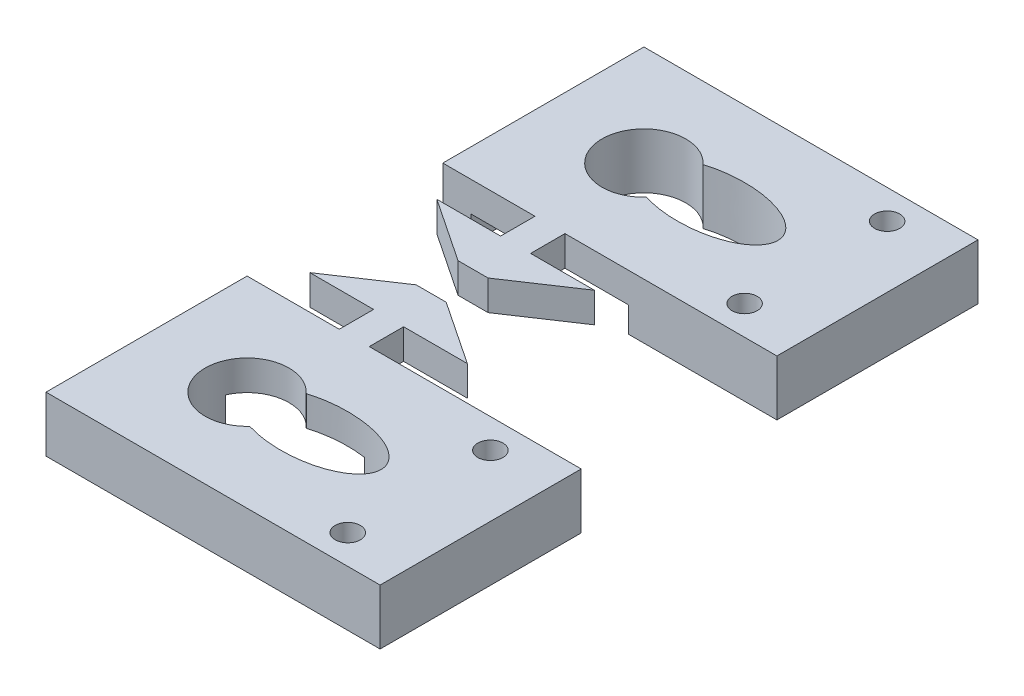
from build123d import *

# Parameters (mm, degrees)
BOSS_EXTRUDE1_DEPTH      = 3.5814
BOSS_EXTRUDE2_DEPTH      = 3.035
BOSS_EXTRUDE2_DEPTH_BACK = 3.035
SKETCH7_W                = 39.878
SKETCH7_H                = 24
CUT_EXTRUDE3_DEPTH       = 39.159389316
CUT_EXTRUDE3_DEPTH_BACK  = 39.159389316
SKETCH5_R                = 1.5
SKETCH8_W                = 18.796
SKETCH8_H                = 3.035
CUT_EXTRUDE4_DEPTH       = 10
CUT_EXTRUDE5_DEPTH       = 2
CUT_EXTRUDE6_DEPTH       = 2


with BuildPart() as part:
    # Sketch1 → Boss-Extrude1 (new body)
    with BuildSketch(Plane(origin=(0, 0, 0), x_dir=(1, 0, 0), z_dir=(0, 1, 0))):
        Polygon((-9.398, 2.05), (-1.7907, 2.05), (-1.7907, -2.05), (-12.79, -2.05), (-12.79, -26.05), (27.088, -26.05), (27.088, -2.05), (1.7907, -2.05), (1.7907, 2.05), (9.398, 2.05), (1.7907, 7.13), (-1.7907, 7.13), align=None)
    extrude(amount=BOSS_EXTRUDE1_DEPTH)

    # Sketch7 → Boss-Extrude2 (add, two sides: drawn at the far end of the back side and taken through both)
    with BuildSketch(Plane(origin=(0, 0, 0), x_dir=(1, 0, 0), z_dir=(0, 1, 0)).offset(-BOSS_EXTRUDE2_DEPTH_BACK)):
        with Locations((7.149, -14.05)):
            Rectangle(SKETCH7_W, SKETCH7_H)
    extrude(amount=BOSS_EXTRUDE2_DEPTH + BOSS_EXTRUDE2_DEPTH_BACK)

    # Sketch5 → Cut-Extrude3 (cut, two sides: drawn at the far end of the back side and taken through both)
    with BuildSketch(Plane(origin=(0, 3.5814, 0), x_dir=(1, 0, 0), z_dir=(0, 1, 0)).offset(-CUT_EXTRUDE3_DEPTH_BACK)):
        with BuildLine():
            ThreePointArc((2.902928009, -10.679201472), (-5.79, -14.05), (2.902928009, -17.420798528))
            add(Edge.make_bspline(
                [(2.902928009, -17.420798528), (15.21, -21.352170028), (15.21, -14.05)],
                knots=[1.002278043, 1.002278043, 1.002278043, 3.141592654, 3.141592654, 3.141592654], degree=2, weights=[1, 0.480424813, 1]))
            add(Edge.make_bspline(
                [(15.21, -14.05), (15.21, -6.747829972), (2.902928009, -10.679201472)],
                knots=[3.141592654, 3.141592654, 3.141592654, 5.280907265, 5.280907265, 5.280907265], degree=2, weights=[1, 0.480424813, 1]))
        make_face()
        with Locations((19.738, -22.559)):
            Circle(SKETCH5_R)
        with Locations((19.738, -5.541)):
            Circle(SKETCH5_R)
    extrude(amount=CUT_EXTRUDE3_DEPTH + CUT_EXTRUDE3_DEPTH_BACK, mode=Mode.SUBTRACT)

    # Sketch8 → Cut-Extrude4 (cut)
    with BuildSketch(Plane(origin=(0, 0, 2.05), x_dir=(-1, 0, 0), z_dir=(0, 0, -1))):
        with Locations((0, -1.5175)):
            Rectangle(SKETCH8_W, SKETCH8_H)
    extrude(amount=-CUT_EXTRUDE4_DEPTH, mode=Mode.SUBTRACT)


with BuildPart() as body_2:
    # Mirror2: mirrored copy
    add(part.part.mirror(Plane(origin=(0, 0, -9.63), x_dir=(1, 0, 0), z_dir=(0, 0, -1))))

    # Sketch9 → Cut-Extrude5 (cut)
    with BuildSketch(Plane(origin=(0, -3.035, 0), x_dir=(-1, 0, 0), z_dir=(0, -1, 0))):
        Polygon((-17.738, 37.495897436), (-17.738, 36.926025641), (-23.436717949, 36.926025641), (-23.436717949, 34.483717949), (-24.088, 34.483717949), (-24.088, 37.495897436), align=None)
        Polygon((-17.575179487, 33.018333333), (-17.575179487, 32.448461538), (-19.447615385, 32.448461538), (-19.447615385, 31.634358974), (-20.017487179, 31.634358974), (-20.017487179, 32.448461538), (-24.088, 32.448461538), (-24.088, 33.018333333), (-20.017487179, 33.018333333), (-20.017487179, 33.832435897), (-19.447615385, 33.832435897), (-19.447615385, 33.018333333), align=None)
        with BuildLine():
            add(Edge.make_bspline(
                [(-23.111076923, 29.965448718), (-23.113108733, 29.93006343), (-23.117068442, 29.861102542), (-23.146170333, 29.76124509), (-23.195273601, 29.669993403), (-23.262741993, 29.58921361), (-23.343290074, 29.52207525), (-23.434309956, 29.47240698), (-23.534456908, 29.441971139), (-23.604412572, 29.438209003), (-23.64024359, 29.436282051)],
                knots=[0, 0, 0, 0, 1.020591893, 1.988988293, 2.974634352, 3.991697318, 5.008760285, 5.983632262, 6.967224335, 8, 8, 8, 8], degree=3))
            add(Edge.make_bspline(
                [(-23.64024359, 29.436282051), (-23.675213037, 29.43828598), (-23.744291317, 29.442244521), (-23.843680497, 29.472343791), (-23.934760899, 29.522464128), (-24.016404016, 29.588755355), (-24.084016838, 29.670013061), (-24.132682258, 29.761465704), (-24.163820493, 29.860863151), (-24.167516873, 29.930023146), (-24.169410256, 29.965448718)],
                knots=[0, 0, 0, 0, 1.009852967, 1.994853009, 2.971120474, 3.99910934, 5.017628188, 6.004685157, 6.977947174, 8, 8, 8, 8], degree=3))
            add(Edge.make_bspline(
                [(-24.169410256, 29.965448718), (-24.167445792, 30.000848781), (-24.163588082, 30.07036554), (-24.133304061, 30.170135394), (-24.083550278, 30.261034458), (-24.016528984, 30.342307987), (-23.934337962, 30.408048617), (-23.844300579, 30.460477937), (-23.744004211, 30.488168669), (-23.675156488, 30.492446223), (-23.64024359, 30.494615385)],
                knots=[0, 0, 0, 0, 1.021616397, 2.006195831, 2.982046417, 4.000130345, 5.027680246, 6.00943514, 6.990578253, 8, 8, 8, 8], degree=3))
            add(Edge.make_bspline(
                [(-23.64024359, 30.494615385), (-23.604471141, 30.49251732), (-23.534748731, 30.48842808), (-23.433690127, 30.460413721), (-23.343708979, 30.408444682), (-23.262618275, 30.341848646), (-23.195738663, 30.261054431), (-23.145557951, 30.170349834), (-23.117297414, 30.070130272), (-23.113178168, 30.000809531), (-23.111076923, 29.965448718)],
                knots=[0, 0, 0, 0, 1.032329927, 2.012066096, 2.992413168, 4.009037178, 5.025661188, 6.000112418, 6.979848586, 8, 8, 8, 8], degree=3))
        make_face()
    extrude(amount=-CUT_EXTRUDE5_DEPTH, mode=Mode.SUBTRACT)


with BuildPart() as part_1:
    add(part.part)

    # Sketch10 → Cut-Extrude6 (cut)
    # profile 1 of 3: a face of its own
    with BuildSketch(Plane.XZ.offset(3.035)):
        with BuildLine():
            add(Edge.make_bspline(
                [(23.111076923, 18.450961538), (23.113178168, 18.486322352), (23.117297414, 18.555643093), (23.145557951, 18.655862654), (23.195738663, 18.746567251), (23.262618275, 18.827361467), (23.343708979, 18.893957503), (23.433690127, 18.945926542), (23.534748731, 18.9739409), (23.604471141, 18.97803014), (23.64024359, 18.980128205)],
                knots=[0, 0, 0, 0, 1.020151414, 1.999887582, 2.974338812, 3.990962822, 5.007586832, 5.987933904, 6.967670073, 8, 8, 8, 8], degree=3))
            add(Edge.make_bspline(
                [(23.64024359, 18.980128205), (23.675162482, 18.977965725), (23.744022024, 18.973701346), (23.844231632, 18.945913902), (23.934315979, 18.89402059), (24.015216612, 18.826937749), (24.083711596, 18.747050426), (24.133227025, 18.655578876), (24.163608262, 18.555896524), (24.167452601, 18.486367731), (24.169410256, 18.450961538)],
                knots=[0, 0, 0, 0, 1.009624703, 1.990965087, 2.972917375, 3.991206001, 5.017354006, 5.993400798, 6.978178195, 8, 8, 8, 8], degree=3))
            add(Edge.make_bspline(
                [(24.169410256, 18.450961538), (24.167523665, 18.415529847), (24.163840545, 18.346357903), (24.13260605, 18.247047191), (24.084184092, 18.155018118), (24.01509192, 18.075151555), (23.934734447, 18.007525099), (23.843611229, 17.957934065), (23.744309211, 17.927737333), (23.675219051, 17.923792076), (23.64024359, 17.921794872)],
                knots=[0, 0, 0, 0, 1.022258411, 1.995716197, 2.98297171, 4.009558169, 5.028281891, 6.00474573, 6.989943903, 8, 8, 8, 8], degree=3))
            add(Edge.make_bspline(
                [(23.64024359, 17.921794872), (23.604412572, 17.923721823), (23.534456908, 17.92748396), (23.434309956, 17.9579198), (23.343290074, 18.007588071), (23.262741993, 18.07472643), (23.195273601, 18.155506224), (23.146170333, 18.246757911), (23.117068442, 18.346615362), (23.113108733, 18.41557625), (23.111076923, 18.450961538)],
                knots=[0, 0, 0, 0, 1.032775665, 2.016367738, 2.991239715, 4.008302682, 5.025365648, 6.011011707, 6.979408107, 8, 8, 8, 8], degree=3))
        make_face()
    # profile 2 of 3: a face of its own
    with BuildSketch(Plane.XZ.offset(3.035)):
        Polygon((17.575179487, 15.398076923), (17.575179487, 15.967948718), (19.447615385, 15.967948718), (19.447615385, 16.782051282), (20.017487179, 16.782051282), (20.017487179, 15.967948718), (24.088, 15.967948718), (24.088, 15.398076923), (20.017487179, 15.398076923), (20.017487179, 14.583974359), (19.447615385, 14.583974359), (19.447615385, 15.398076923), align=None)
    # profile 3 of 3: a face of its own
    with BuildSketch(Plane.XZ.offset(3.035)):
        with BuildLine():
            Line((17.738, 9.617948718), (17.738, 10.888711939))
            add(Edge.make_bspline(
                [(17.738, 10.888711939), (17.738282277, 10.973513701), (17.738824281, 11.136342477), (17.741846451, 11.369611125), (17.750508497, 11.581568858), (17.757962641, 11.772104852), (17.771555163, 11.941215612), (17.784546623, 12.089419696), (17.801553122, 12.216034519), (17.817347246, 12.292680564), (17.824498397, 12.327383814)],
                knots=[0, 0, 0, 0, 1.410062039, 2.707475311, 3.878576406, 4.937260626, 5.877586885, 6.699081471, 7.410979367, 8, 8, 8, 8], degree=3))
            add(Edge.make_bspline(
                [(17.824498397, 12.327383814), (17.835976988, 12.37384151), (17.858689301, 12.465765834), (17.906694128, 12.598118621), (17.96224853, 12.724235532), (18.027490962, 12.84360412), (18.102941892, 12.955584306), (18.187164461, 13.061488405), (18.279988558, 13.160972648), (18.382250961, 13.252738685), (18.491772821, 13.336094467), (18.608253551, 13.409210327), (18.731211529, 13.470991884), (18.860838269, 13.519474548), (18.995701849, 13.560156831), (19.137178756, 13.587490314), (19.284796694, 13.604516403), (19.385237963, 13.606198413), (19.436167067, 13.607051282)],
                knots=[0, 0, 0, 0, 1.02737844, 2.032840108, 3.019645024, 3.985760442, 4.950801802, 5.916702504, 6.889791722, 7.870143693, 8.864820395, 9.842884691, 10.820524757, 11.815201459, 12.812418953, 13.84314332, 14.906358105, 16, 16, 16, 16], degree=3))
            add(Edge.make_bspline(
                [(19.436167067, 13.607051282), (19.520776471, 13.6043861), (19.685871333, 13.599185639), (19.925467504, 13.550698665), (20.148968117, 13.471275551), (20.35609176, 13.361831869), (20.542801074, 13.222459392), (20.706795186, 13.054955842), (20.844027599, 12.859227776), (20.939191973, 12.677020302), (21.000139107, 12.516067397), (21.043022215, 12.383564101), (21.076154638, 12.239025442), (21.105836592, 12.083836278), (21.128246094, 11.917350789), (21.144659201, 11.739968003), (21.154917261, 11.551561413), (21.156444899, 11.422131959), (21.157230769, 11.355548878)],
                knots=[0, 0, 0, 0, 1.260483769, 2.459530307, 3.627416485, 4.787058657, 5.939039949, 7.08810263, 8.267026773, 9.491475466, 10.141966685, 10.831826277, 11.566392101, 12.351337768, 13.187381173, 14.07005841, 15.007169909, 16, 16, 16, 16], degree=3))
            Line((21.157230769, 11.355548878), (24.088, 13.688461538))
            Line((24.088, 13.688461538), (24.088, 12.983754006))
            Line((24.088, 12.983754006), (21.157230769, 10.650841346))
            Line((21.157230769, 10.650841346), (21.157230769, 10.187820513))
            Line((21.157230769, 10.187820513), (24.088, 10.187820513))
            Line((24.088, 10.187820513), (24.088, 9.617948718))
            Line((24.088, 9.617948718), (17.738, 9.617948718))
        make_face()
        with BuildLine():
            Line((18.389282051, 10.187820513), (20.505948718, 10.187820513))
            Line((20.505948718, 10.187820513), (20.514852965, 11.350460737))
            add(Edge.make_bspline(
                [(20.514852965, 11.350460737), (20.514876994, 11.404744243), (20.514923569, 11.509961139), (20.507677529, 11.662180821), (20.499435294, 11.80391335), (20.48682505, 11.93461477), (20.470583229, 12.054349543), (20.450234815, 12.163037944), (20.426629591, 12.260922238), (20.389715634, 12.374713915), (20.333786234, 12.503282147), (20.246917826, 12.639952932), (20.142539044, 12.759870581), (20.019736564, 12.8575346), (19.886860538, 12.939361136), (19.742550068, 12.99442714), (19.591486445, 13.031126295), (19.487693972, 13.035138493), (19.434895032, 13.037179487)],
                knots=[0, 0, 0, 0, 1.146477201, 2.22219935, 3.21835465, 4.145220026, 4.995151787, 5.769831222, 6.480173269, 7.120302478, 8.295254187, 9.430763426, 10.528629691, 11.636497428, 12.733230534, 13.811001502, 14.886462612, 16, 16, 16, 16], degree=3))
            add(Edge.make_bspline(
                [(19.434895032, 13.037179487), (19.383833269, 13.034992201), (19.282647488, 13.030657799), (19.134439291, 12.995464462), (18.994516998, 12.935297932), (18.862699948, 12.856148597), (18.744914152, 12.756815842), (18.64304065, 12.642580192), (18.559643163, 12.51346363), (18.504214172, 12.393849565), (18.471663171, 12.286079685), (18.448004083, 12.192954149), (18.431583793, 12.087213809), (18.416030786, 11.969339538), (18.403440206, 11.839106381), (18.394755396, 11.696132636), (18.38966918, 11.541303978), (18.389414097, 11.433995031), (18.389282051, 11.378445513)],
                knots=[0, 0, 0, 0, 1.100823979, 2.181431445, 3.263702604, 4.376021382, 5.48638238, 6.575013887, 7.666064109, 8.791843368, 9.405226397, 10.093019944, 10.863016055, 11.711746407, 12.658404307, 13.684961631, 14.801597923, 16, 16, 16, 16], degree=3))
            Line((18.389282051, 11.378445513), (18.389282051, 10.187820513))
        make_face(mode=Mode.SUBTRACT)
    extrude(amount=-CUT_EXTRUDE6_DEPTH, mode=Mode.SUBTRACT)


solid = Compound([body_2.part, part_1.part])
